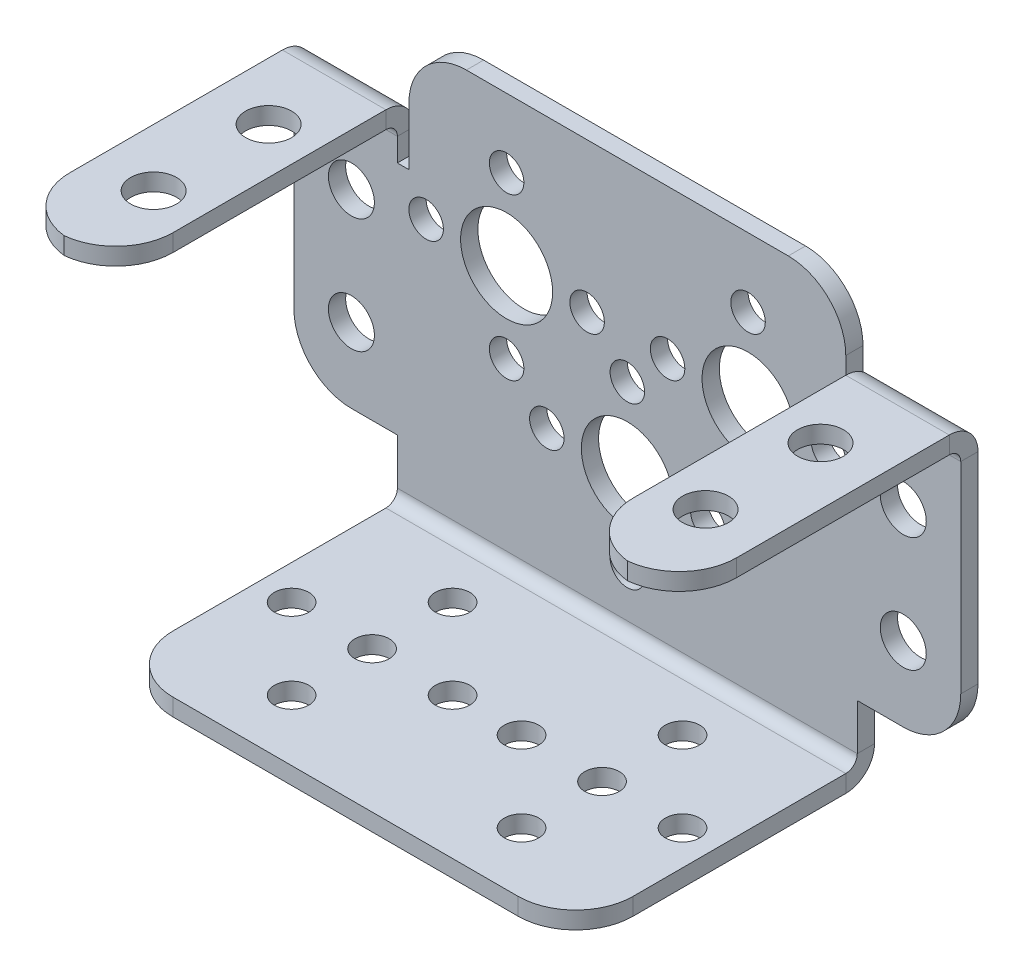
from build123d import *

# Parameters (mm, degrees)
BRIDA_BASE2_DEPTH                = 1.5
BRIDA_DE_ARISTA3_STRIP_W         = 8
BRIDA_DE_ARISTA3_STRIP_H         = 1.5
BRIDA_DE_ARISTA3_STRIP_CUT_DEPTH = 40
BRIDA_DE_ARISTA3_DEPTH           = 40
BRIDA_DE_ARISTA4_STRIP_W         = 8
BRIDA_DE_ARISTA4_STRIP_H         = 1.5
BRIDA_DE_ARISTA4_STRIP_CUT_DEPTH = 9
BRIDA_DE_ARISTA4_DEPTH           = 9
BRIDA_DE_ARISTA5_STRIP_W         = 8
BRIDA_DE_ARISTA5_STRIP_H         = 1.5
BRIDA_DE_ARISTA5_STRIP_CUT_DEPTH = 9
BRIDA_DE_ARISTA5_DEPTH           = 9
REDONDEO1_R                      = 5
REDONDEO2_R                      = 5
REDONDEO3_R                      = 5
REDONDEO4_R                      = 5
REDONDEO5_R                      = 5
REDONDEO6_R                      = 5
REDONDEO7_R                      = 5
REDONDEO8_R                      = 5
CROQUIS39_R                      = 4
CORTAR_EXTRUIR2_DEPTH            = 2
CROQUIS40_R                      = 1.5
CORTAR_EXTRUIR3_DEPTH            = 2
MATRIZC1_COUNT                   = 4
CROQUIS41_R                      = 1.5
CORTAR_EXTRUIR4_DEPTH            = 2
MATRIZC2_COUNT                   = 4
CROQUIS42_R                      = 1.5
CORTAR_EXTRUIR5_DEPTH            = 2
MATRIZC3_COUNT                   = 4
CROQUIS46_R                      = 2
CORTAR_EXTRUIR9_DEPTH            = 2
CROQUIS49_R                      = 2
CORTAR_EXTRUIR10_DEPTH           = 2
CROQUIS51_R                      = 1.500000001
CORTAR_EXTRUIR11_DEPTH           = 2
CROQUIS52_R                      = 1.500000001
CORTAR_EXTRUIR12_DEPTH           = 2
CROQUIS53_R                      = 1.500000001
CORTAR_EXTRUIR13_DEPTH           = 2
MATRIZC4_COUNT                   = 4
MATRIZC5_COUNT                   = 4


# Sheet-metal steps are written as plain solids
with BuildPart() as part:
    # Croquis1 → Brida base2 (new body)
    with BuildSketch(Plane.XY):
        Polygon((20, -17.745), (20, -12.745), (29, -12.745), (29, 10.755), (20, 10.755), (20, 7.745), (19, 7.745), (19, 17.745), (-19, 17.745), (-19, 7.745), (-20, 7.745), (-20, 10.755), (-29, 10.755), (-29, -12.745), (-20, -12.745), (-20, -17.745), align=None)
    extrude(amount=-BRIDA_BASE2_DEPTH)

    # Brida de arista3 strip (across the edge) → Brida de arista3 strip cut (cut)
    with BuildSketch(Plane(origin=(-20, -17.745, 0), x_dir=(0, 1, 0), z_dir=(1, 0, 0))):
        with Locations((-3, -0.75)):
            Rectangle(BRIDA_DE_ARISTA3_STRIP_W, BRIDA_DE_ARISTA3_STRIP_H)
    extrude(amount=BRIDA_DE_ARISTA3_STRIP_CUT_DEPTH, mode=Mode.SUBTRACT)

    # Brida de arista3 section (across the edge) → Brida de arista3 (add)
    with BuildSketch(Plane(origin=(-20, -17.745, 0), x_dir=(0, 1, 0), z_dir=(1, 0, 0))):
        with BuildLine():
            Line((-1.5, 1), (-1.5, 24.5))
            Line((-1.5, 24.5), (0, 24.5))
            Line((0, 24.5), (0, 1))
            ThreePointArc((0, 1), (0.292893219, 0.292893219), (1, 0))
            Line((1, 0), (1, -1.5))
            ThreePointArc((1, -1.5), (-0.767766953, -0.767766953), (-1.5, 1))
        make_face()
    extrude(amount=BRIDA_DE_ARISTA3_DEPTH)

    # Brida de arista4 strip (across the edge) → Brida de arista4 strip cut (cut)
    with BuildSketch(Plane(origin=(29, 10.755, 0), x_dir=(0, -1, 0), z_dir=(-1, 0, 0))):
        with Locations((-3, -0.75)):
            Rectangle(BRIDA_DE_ARISTA4_STRIP_W, BRIDA_DE_ARISTA4_STRIP_H)
    extrude(amount=BRIDA_DE_ARISTA4_STRIP_CUT_DEPTH, mode=Mode.SUBTRACT)

    # Brida de arista4 section (across the edge) → Brida de arista4 (add)
    with BuildSketch(Plane(origin=(29, 10.755, 0), x_dir=(0, -1, 0), z_dir=(-1, 0, 0))):
        with BuildLine():
            Line((-1.5, 1), (-1.5, 24.5))
            Line((-1.5, 24.5), (0, 24.5))
            Line((0, 24.5), (0, 1))
            ThreePointArc((0, 1), (0.292893219, 0.292893219), (1, 0))
            Line((1, 0), (1, -1.5))
            ThreePointArc((1, -1.5), (-0.767766953, -0.767766953), (-1.5, 1))
        make_face()
    extrude(amount=BRIDA_DE_ARISTA4_DEPTH)

    # Brida de arista5 strip (across the edge) → Brida de arista5 strip cut (cut)
    with BuildSketch(Plane(origin=(-20, 10.755, 0), x_dir=(0, -1, 0), z_dir=(-1, 0, 0))):
        with Locations((-3, -0.75)):
            Rectangle(BRIDA_DE_ARISTA5_STRIP_W, BRIDA_DE_ARISTA5_STRIP_H)
    extrude(amount=BRIDA_DE_ARISTA5_STRIP_CUT_DEPTH, mode=Mode.SUBTRACT)

    # Brida de arista5 section (across the edge) → Brida de arista5 (add)
    with BuildSketch(Plane(origin=(-20, 10.755, 0), x_dir=(0, -1, 0), z_dir=(-1, 0, 0))):
        with BuildLine():
            Line((-1.5, 1), (-1.5, 24.5))
            Line((-1.5, 24.5), (0, 24.5))
            Line((0, 24.5), (0, 1))
            ThreePointArc((0, 1), (0.292893219, 0.292893219), (1, 0))
            Line((1, 0), (1, -1.5))
            ThreePointArc((1, -1.5), (-0.767766953, -0.767766953), (-1.5, 1))
        make_face()
    extrude(amount=BRIDA_DE_ARISTA5_DEPTH)

    # Redondeo1
    redondeo1_edges = [part.edges().sort_by_distance(p)[0] for p in [
        (19, 17.745, -0.75),
    ]]
    fillet(redondeo1_edges, radius=REDONDEO1_R)

    # Redondeo2
    redondeo2_edges = [part.edges().sort_by_distance(p)[0] for p in [
        (-19, 17.745, -0.75),
    ]]
    fillet(redondeo2_edges, radius=REDONDEO2_R)

    # Redondeo3
    redondeo3_edges = [part.edges().sort_by_distance(p)[0] for p in [
        (-29, -12.745, -0.75),
    ]]
    fillet(redondeo3_edges, radius=REDONDEO3_R)

    # Redondeo4
    redondeo4_edges = [part.edges().sort_by_distance(p)[0] for p in [
        (29, -12.745, -0.75),
    ]]
    fillet(redondeo4_edges, radius=REDONDEO4_R)

    # Redondeo5
    redondeo5_edges = [part.edges().sort_by_distance(p)[0] for p in [
        (20, -18.495, 24.5),
    ]]
    fillet(redondeo5_edges, radius=REDONDEO5_R)

    # Redondeo6
    redondeo6_edges = [part.edges().sort_by_distance(p)[0] for p in [
        (-20, -18.495, 24.5),
    ]]
    fillet(redondeo6_edges, radius=REDONDEO6_R)

    # Redondeo7
    # the kernel refuses this fillet: 5 mm, written as the material it takes off along each edge
    with BuildSketch(Plane(origin=(20, 24.755, 24.5), x_dir=(0, 0, -1), z_dir=(0, -1, 0))) as redondeo7_piece_1:
        with BuildLine():
            CenterArc((REDONDEO7_R, REDONDEO7_R), REDONDEO7_R, 180, 90)
            Line((0, REDONDEO7_R), (0, 0))
            Line((0, 0), (REDONDEO7_R, 0))
        make_face()
    extrude(amount=26.5, mode=Mode.SUBTRACT)
    with BuildSketch(Plane(origin=(29, 24.755, 24.5), x_dir=(0, 0, -1), z_dir=(0, -1, 0))) as redondeo7_piece_2:
        with BuildLine():
            CenterArc((REDONDEO7_R, -REDONDEO7_R), REDONDEO7_R, 90, 90)
            Line((0, -REDONDEO7_R), (0, 0))
            Line((0, 0), (REDONDEO7_R, 0))
        make_face()
    extrude(amount=26.5, mode=Mode.SUBTRACT)

    # Redondeo8
    # the kernel refuses this fillet: 5 mm, written as the material it takes off along each edge
    with BuildSketch(Plane(origin=(-29, 24.755, 24.5), x_dir=(0, 0, -1), z_dir=(0, -1, 0))) as redondeo8_piece_1:
        with BuildLine():
            CenterArc((REDONDEO8_R, REDONDEO8_R), REDONDEO8_R, 180, 90)
            Line((0, REDONDEO8_R), (0, 0))
            Line((0, 0), (REDONDEO8_R, 0))
        make_face()
    extrude(amount=26.5, mode=Mode.SUBTRACT)
    with BuildSketch(Plane(origin=(-20, 24.755, 24.5), x_dir=(0, 0, -1), z_dir=(0, -1, 0))) as redondeo8_piece_2:
        with BuildLine():
            CenterArc((REDONDEO8_R, -REDONDEO8_R), REDONDEO8_R, 90, 90)
            Line((0, -REDONDEO8_R), (0, 0))
            Line((0, 0), (REDONDEO8_R, 0))
        make_face()
    extrude(amount=26.5, mode=Mode.SUBTRACT)

    # Croquis39 → Cortar-Extruir2 (cut)
    with BuildSketch(Plane.XY):
        with Locations((-10.5, 4.755)):
            Circle(CROQUIS39_R)
        with Locations((10.5, 4.755)):
            Circle(CROQUIS39_R)
        with Locations((0, -5.745)):
            Circle(CROQUIS39_R)
    extrude(amount=-CORTAR_EXTRUIR2_DEPTH, mode=Mode.SUBTRACT)

    # Croquis40 → Cortar-Extruir3 (cut)
    with BuildSketch(Plane.XY):
        with Locations((-10.5, 11.755)):
            Circle(CROQUIS40_R)
    cortar_extruir3 = extrude(amount=-CORTAR_EXTRUIR3_DEPTH, mode=Mode.SUBTRACT)

    # MatrizC1: Cortar-Extruir3 ×4 about axis
    matrizc1_axis = Axis((-10.5, 4.755, 0), (0, 0, 1))
    for i in range(1, MATRIZC1_COUNT):
        add(cortar_extruir3.rotate(matrizc1_axis, i * 360 / MATRIZC1_COUNT), mode=Mode.SUBTRACT)

    # Croquis41 → Cortar-Extruir4 (cut)
    with BuildSketch(Plane.XY):
        with Locations((0, 1.255)):
            Circle(CROQUIS41_R)
    cortar_extruir4 = extrude(amount=-CORTAR_EXTRUIR4_DEPTH, mode=Mode.SUBTRACT)

    # MatrizC2: Cortar-Extruir4 ×4 about axis
    matrizc2_axis = Axis((0, -5.745, 0), (0, 0, 1))
    for i in range(1, MATRIZC2_COUNT):
        add(cortar_extruir4.rotate(matrizc2_axis, i * 360 / MATRIZC2_COUNT), mode=Mode.SUBTRACT)

    # Croquis42 → Cortar-Extruir5 (cut)
    with BuildSketch(Plane.XY):
        with Locations((10.5, 11.755)):
            Circle(CROQUIS42_R)
    cortar_extruir5 = extrude(amount=-CORTAR_EXTRUIR5_DEPTH, mode=Mode.SUBTRACT)

    # MatrizC3: Cortar-Extruir5 ×4 about axis
    matrizc3_axis = Axis((10.5, 4.755, 0), (0, 0, 1))
    for i in range(1, MATRIZC3_COUNT):
        add(cortar_extruir5.rotate(matrizc3_axis, i * 360 / MATRIZC3_COUNT), mode=Mode.SUBTRACT)

    # Croquis46 → Cortar-Extruir9 (cut)
    with BuildSketch(Plane.XY):
        with Locations((24, 3.755)):
            Circle(CROQUIS46_R)
        with Locations((24, -6.245)):
            Circle(CROQUIS46_R)
        with Locations((-24, 3.755)):
            Circle(CROQUIS46_R)
        with Locations((-24, -6.245)):
            Circle(CROQUIS46_R)
    extrude(amount=-CORTAR_EXTRUIR9_DEPTH, mode=Mode.SUBTRACT)

    # Croquis49 → Cortar-Extruir10 (cut)
    with BuildSketch(Plane(origin=(0, 12.255, 0), x_dir=(1, 0, 0), z_dir=(0, 1, 0))):
        with Locations(Location((-24, -7.199489743, 0), (0, 0, 270))):
            Circle(CROQUIS49_R)
        with Locations(Location((24, -7.199489743, 0), (0, 0, 270))):
            Circle(CROQUIS49_R)
        with Locations(Location((24, -17.199489743, 0), (0, 0, 270))):
            Circle(CROQUIS49_R)
        with Locations(Location((-24, -17.199489743, 0), (0, 0, 270))):
            Circle(CROQUIS49_R)
    extrude(amount=-CORTAR_EXTRUIR10_DEPTH, mode=Mode.SUBTRACT)

    # Croquis51 → Cortar-Extruir11 (cut)
    with BuildSketch(Plane(origin=(0, -17.745, 0), x_dir=(1, 0, 0), z_dir=(0, 1, 0))):
        with Locations(Location((-10, -12.199489743, 0), (0, 0, 270))):
            Circle(CROQUIS51_R)
        with Locations(Location((10, -12.199489743, 0), (0, 0, 270))):
            Circle(CROQUIS51_R)
    extrude(amount=-CORTAR_EXTRUIR11_DEPTH, mode=Mode.SUBTRACT)

    # Croquis52 → Cortar-Extruir12 (cut)
    with BuildSketch(Plane(origin=(0, -17.745, 0), x_dir=(1, 0, 0), z_dir=(0, 1, 0))):
        with Locations(Location((-10, -5.199489743, 0), (0, 0, 270))):
            Circle(CROQUIS52_R)
    cortar_extruir12 = extrude(amount=-CORTAR_EXTRUIR12_DEPTH, mode=Mode.SUBTRACT)

    # Croquis53 → Cortar-Extruir13 (cut)
    with BuildSketch(Plane(origin=(0, -17.745, 0), x_dir=(1, 0, 0), z_dir=(0, 1, 0))):
        with Locations(Location((10, -5.199489743, 0), (0, 0, 270))):
            Circle(CROQUIS53_R)
    cortar_extruir13 = extrude(amount=-CORTAR_EXTRUIR13_DEPTH, mode=Mode.SUBTRACT)

    # MatrizC4: Cortar-Extruir12 ×4 about axis
    matrizc4_axis = Axis((-10, 0, 12.199489743), (0, 1, 0))
    for i in range(1, MATRIZC4_COUNT):
        add(cortar_extruir12.rotate(matrizc4_axis, i * 360 / MATRIZC4_COUNT), mode=Mode.SUBTRACT)

    # MatrizC5: Cortar-Extruir13 ×4 about axis
    matrizc5_axis = Axis((10, 0, 12.199489743), (0, 1, 0))
    for i in range(1, MATRIZC5_COUNT):
        add(cortar_extruir13.rotate(matrizc5_axis, i * 360 / MATRIZC5_COUNT), mode=Mode.SUBTRACT)


solid = part.part
